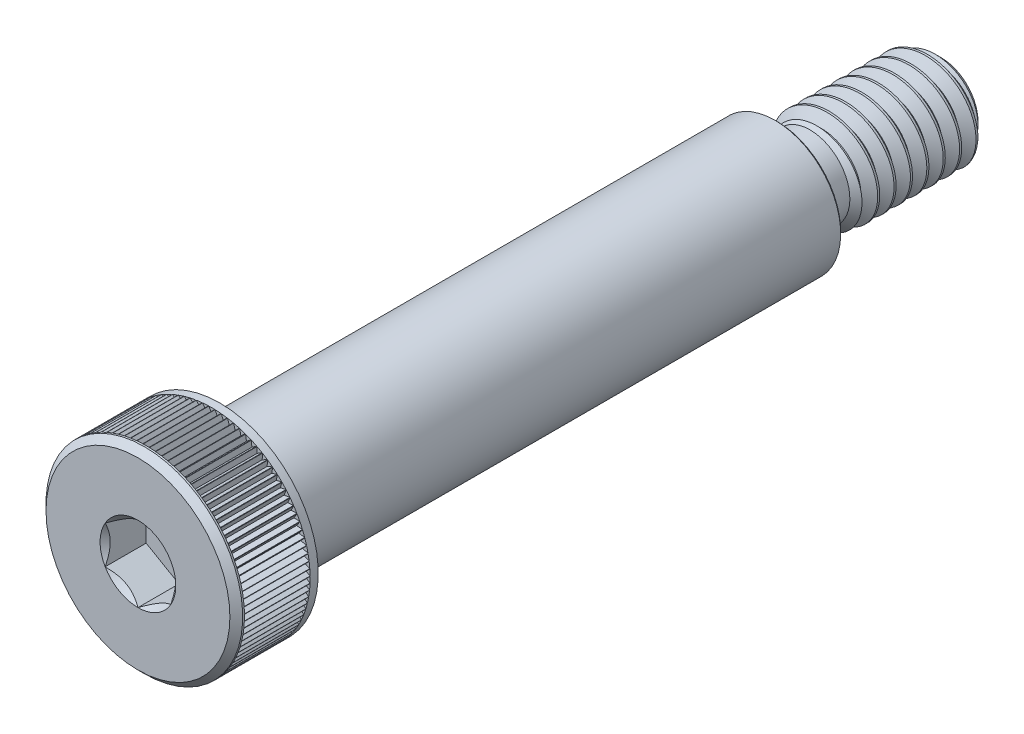
from build123d import *

# Parameters (mm, degrees)
CHAMFER1_SIZE      = 1.190625
CHAMFER2_SIZE      = 0.619125
CHAMFER3_SIZE      = 0.2032
CUT_EXTRUDE5_DEPTH = 3.18214375
CIRPATTERN1_COUNT  = 99
CUT_EXTRUDE2_DEPTH = 3.96875
CUT_SWEEP1_PITCH   = 1.5875


with BuildPart() as part:
    # Sketch1 → Revolve1 (revolve)
    with BuildSketch(Plane(origin=(0, 0, 0), x_dir=(0, 0, -1), z_dir=(1, 0, 0))):
        Polygon((0, 9.525), (7.9375, 9.525), (7.9375, 6.35), (61.9125, 6.35), (61.9125, 4.7625), (77.7875, 4.7625), (77.7875, 0), (0, 0), align=None)
    revolve(axis=Axis((0, 0, -77.7875), (0, 0, 1)))

    # Sketch5 → Cut-Revolve1 (revolve, cut)
    with BuildSketch(Plane(origin=(0, 0, 0), x_dir=(0, 0, -1), z_dir=(1, 0, 0))):
        with BuildLine():
            Line((61.9125, 6.35), (67.5767, 6.35))
            Line((67.5767, 6.35), (65.0875, 3.8608))
            Line((65.0875, 3.8608), (62.8142, 3.8608))
            ThreePointArc((62.8142, 3.8608), (62.176601815, 4.124901815), (61.9125, 4.7625))
            Line((61.9125, 4.7625), (61.9125, 6.35))
        make_face()
    revolve(axis=Axis((0, 0, -77.7875), (0, 0, 1)), mode=Mode.SUBTRACT)

    # Chamfer1
    chamfer1_edges = [part.edges().sort_by_distance(p)[0] for p in [
        (0, -4.7625, -77.7875),
    ]]
    chamfer(chamfer1_edges, length=CHAMFER1_SIZE)

    # Chamfer2
    chamfer2_edges = [part.edges().sort_by_distance(p)[0] for p in [
        (0, -9.525, 0),
    ]]
    chamfer(chamfer2_edges, length=CHAMFER2_SIZE)

    # Chamfer3
    chamfer3_edges = [part.edges().sort_by_distance(p)[0] for p in [
        (0, -6.35, -61.9125),
    ]]
    chamfer(chamfer3_edges, length=CHAMFER3_SIZE)

    # Sketch11 → Cut-Extrude5 (cut, symmetric)
    with BuildSketch(Plane.XY.offset(-3.96875)):
        Polygon((0, 9.0297), (0.285961588, 9.525), (-0.285961588, 9.525), align=None)
    cut_extrude5 = extrude(amount=CUT_EXTRUDE5_DEPTH, both=True, mode=Mode.SUBTRACT)

    # CirPattern1: Cut-Extrude5 ×99 about axis
    cirpattern1_axis = Axis((0, 0, 0), (0, 0, 1))
    for i in range(1, CIRPATTERN1_COUNT):
        add(cut_extrude5.rotate(cirpattern1_axis, i * 360 / CIRPATTERN1_COUNT), mode=Mode.SUBTRACT)

    # Sketch8 → Cut-Extrude2 (cut)
    with BuildSketch(Plane.XY):
        Polygon((3.175, 1.833087105), (0, 3.666174209), (-3.175, 1.833087105), (-3.175, -1.833087105), (0, -3.666174209), (3.175, -1.833087105), align=None)
    extrude(amount=-CUT_EXTRUDE2_DEPTH, mode=Mode.SUBTRACT)

    # Cut-Extrude4 cone 1 section (through the dimple's axis) → Cut-Extrude4 (revolve, cut)
    with BuildSketch(Plane(origin=(0, 0, 0), x_dir=(0, -1, 0), z_dir=(1, 0, 0))):
        Polygon((0, 0), (3.666174209, 0), (0, 3.666174209), align=None)
    revolve(axis=Axis((0, 0, 0), (0, 0, -1)), mode=Mode.SUBTRACT)

    # Cut-Sweep1: the profile of Sketch4 screwed along a right-hand helix of 11 turns, 8 arcs to a turn; built about Z, then put on its axis
    cut_sweep1_z = Axis((0, 0, 0), (0, 0, 1))
    cut_sweep1_corners = [(4.848425958, 0, 0.049609375), (4.848425958, 0, -1.438671875), (3.731388504, 0, -0.79375), (3.731388504, 0, -0.5953125)]
    with BuildLine(mode=Mode.PRIVATE) as cut_sweep1_profile:
        Line(cut_sweep1_corners[0], cut_sweep1_corners[1])
        Line(cut_sweep1_corners[1], cut_sweep1_corners[2])
        Line(cut_sweep1_corners[2], cut_sweep1_corners[3])
        Line(cut_sweep1_corners[3], cut_sweep1_corners[0])
    cut_sweep1_cap = Face(cut_sweep1_profile.wire())
    cut_sweep1_turn_angles = [0, 22.5, 45, 67.5, 90, 112.5, 135, 157.5, 180, 202.5, 225, 247.5, 270, 292.5, 315, 337.5, 360]
    cut_sweep1_turn_weights = [1, 0.9238795325112867, 1, 0.9238795325112867, 1, 0.9238795325112867, 1, 0.9238795325112867, 1, 0.9238795325112867, 1, 0.9238795325112867, 1, 0.9238795325112867, 1, 0.9238795325112867, 1]
    cut_sweep1_turn_rails = [Edge.make_bspline([Vector(p[0], p[1], 0).rotate(cut_sweep1_z, cut_sweep1_turn_angles[k]) / cut_sweep1_turn_weights[k] + Vector(0, 0, p[2] + CUT_SWEEP1_PITCH * cut_sweep1_turn_angles[k] / 360) for k in range(17)], [0, 0, 0, 1, 1, 2, 2, 3, 3, 4, 4, 5, 5, 6, 6, 7, 7, 8, 8, 8], 2, cut_sweep1_turn_weights) for p in cut_sweep1_corners]
    cut_sweep1_turn_sides = [Face.make_surface_from_curves(cut_sweep1_turn_rails[p[0]], cut_sweep1_turn_rails[p[1]]) for p in [(0, 1), (1, 2), (2, 3), (3, 0)]]
    cut_sweep1 = Plane(origin=(0, 0, -77.7875), x_dir=(0, 1, 0), z_dir=(0, 0, 1)) * Solid(Shell([*[p.moved(Location((0, 0, CUT_SWEEP1_PITCH * i))) for i in range(11) for p in cut_sweep1_turn_sides], cut_sweep1_cap, cut_sweep1_cap.rotate(cut_sweep1_z, 3960).moved(Location((0, 0, CUT_SWEEP1_PITCH * 3960 / 360)))]))
    add(cut_sweep1, mode=Mode.SUBTRACT)

    # Sketch12 → Revolve2 (revolve)
    with BuildSketch(Plane(origin=(0, 0, 0), x_dir=(0, 0, -1), z_dir=(1, 0, 0)), mode=Mode.PRIVATE) as revolve2_sk:
        with BuildLine():
            Line((61.9125, 6.1468), (61.7093, 6.35))
            Line((61.7093, 6.35), (7.9375, 6.35))
            Line((7.9375, 6.35), (7.9375, 0))
            Line((7.9375, 0), (61.9125, 0))
            Line((61.9125, 0), (65.0875, 0))
            Line((65.0875, 0), (65.0875, 3.8608))
            Line((65.0875, 3.8608), (62.8142, 3.8608))
            ThreePointArc((62.8142, 3.8608), (62.176601815, 4.124901815), (61.9125, 4.7625))
            Line((61.9125, 4.7625), (61.9125, 6.1468))
        make_face()
    revolve(revolve2_sk.sketch.rotate(Axis((0, 0, -7.9375), (0, 0, -1)), 189.052465709), axis=Axis((0, 0, -7.9375), (0, 0, -1)))


solid = part.part
